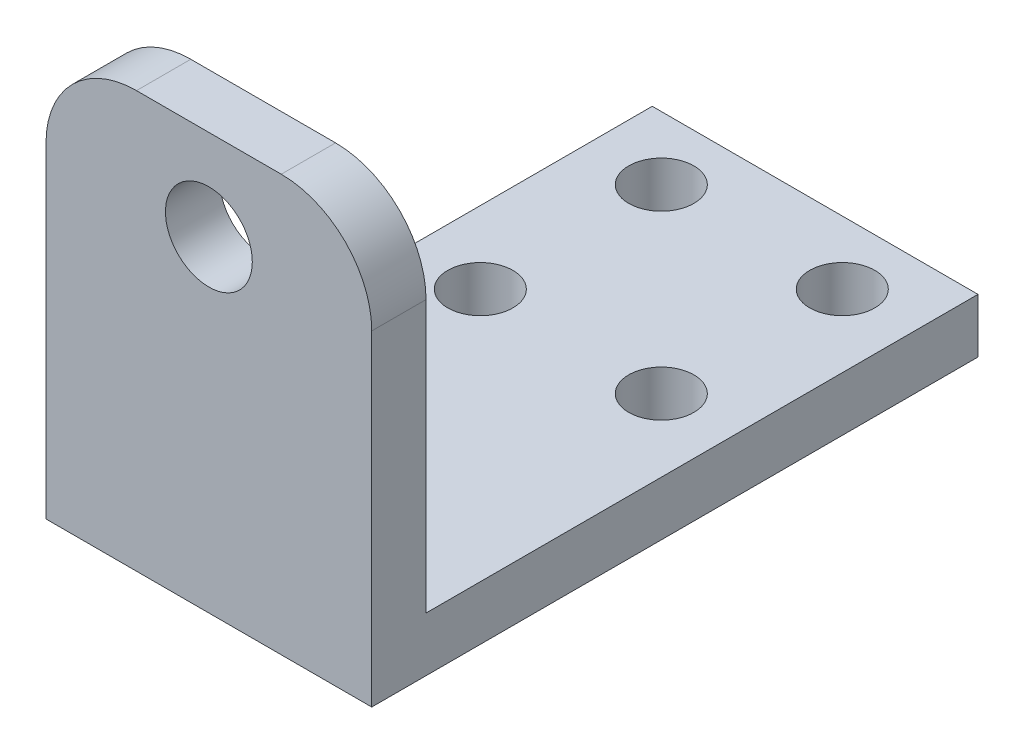
from build123d import *

# Parameters (mm, degrees)
BOSS_EXTRUDE1_DEPTH      = 18
M4_CLEARANCE_HOLE1_D     = 4.8
M4_CLEARANCE_HOLE1_DEPTH = 3
M4_CLEARANCE_HOLE1_TIP   = 1.442065486
FILLET1_R                = 5
M3_CLEARANCE_HOLE1_D     = 3.6


with BuildPart() as part:
    # Sketch1 → Boss-Extrude1 (new body)
    with BuildSketch(Plane(origin=(0, 0, 0), x_dir=(0, 0, -1), z_dir=(1, 0, 0))):
        Polygon((0, 0), (33.5, 0), (33.5, 3), (3, 3), (3, 23), (0, 23), align=None)
    extrude(amount=BOSS_EXTRUDE1_DEPTH)

    # M4 Clearance Hole1
    with Locations(Plane.XY):
        with Locations((9, 18)):
            Hole(M4_CLEARANCE_HOLE1_D / 2, depth=M4_CLEARANCE_HOLE1_DEPTH)
            with Locations((0, 0, -(M4_CLEARANCE_HOLE1_DEPTH + M4_CLEARANCE_HOLE1_TIP / 2))):  # 118° drill point
                Cone(0, M4_CLEARANCE_HOLE1_D / 2, M4_CLEARANCE_HOLE1_TIP, mode=Mode.SUBTRACT)

    # Fillet1
    fillet1_edges = [part.edges().sort_by_distance(p)[0] for p in [
        (0, 23, -1.5),
        (18, 23, -1.5),
    ]]
    fillet(fillet1_edges, radius=FILLET1_R)

    # M3 Clearance Hole1 (through all)
    with Locations(Plane(origin=(0, 3, 0), x_dir=(1, 0, 0), z_dir=(0, 1, 0))):
        with Locations((14, 30), (4, 30), (4, 20), (14, 20)):
            Hole(M3_CLEARANCE_HOLE1_D / 2)


solid = part.part
